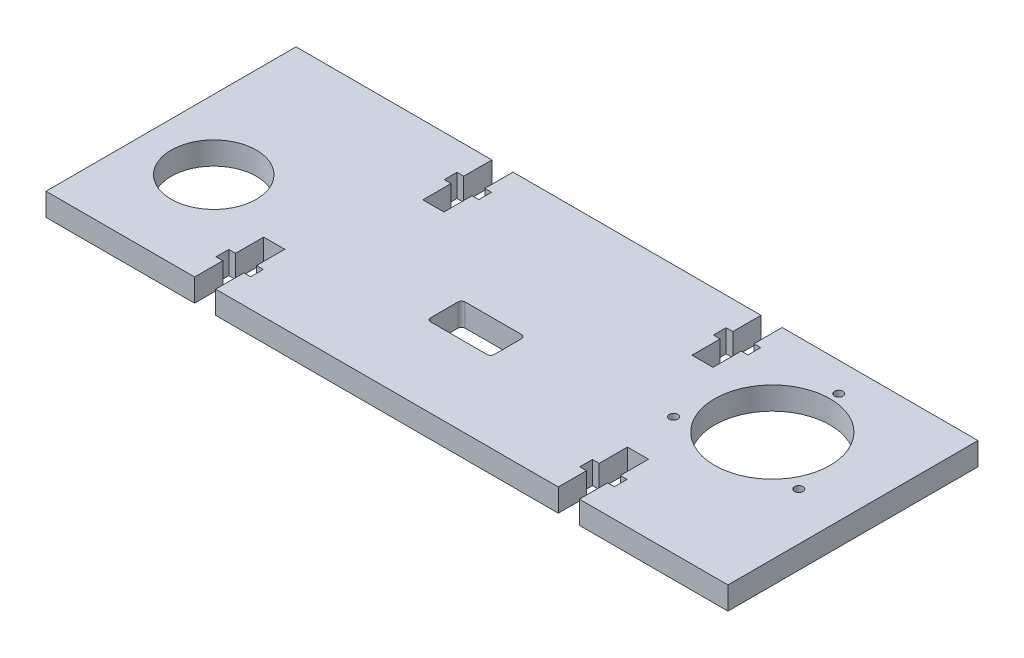
from build123d import *

# Parameters (mm, degrees)
SKETCH1_W                 = 95.25
SKETCH1_H                 = 34.925
BOSS_EXTRUDE1_DEPTH       = 3.175
TAP_DRILL_FOR_0_80_TAP1_D = 1.19126
F_7_16_CLEARANCE_HOLE1_D  = 11.90498
SKETCH6_W                 = 8.89
SKETCH6_H                 = 4.826
CUT_EXTRUDE1_DEPTH        = 51.824798635
CUT_EXTRUDE3_DEPTH        = 51.824798635
SKETCH9_R                 = 8.0645
CUT_EXTRUDE4_DEPTH        = 51.824798635
FILLET1_R                 = 0.508


with BuildPart() as part:
    # Sketch1 → Boss-Extrude1 (new body)
    with BuildSketch(Plane(origin=(0, 0, 0), x_dir=(1, 0, 0), z_dir=(0, 1, 0))):
        Rectangle(SKETCH1_W, SKETCH1_H)
    extrude(amount=BOSS_EXTRUDE1_DEPTH)

    # Tap Drill for #0-80 Tap1 (through all)
    with Locations(Plane(origin=(0, 3.175, 0), x_dir=(1, 0, 0), z_dir=(0, 1, 0))):
        with Locations((40.97655, -0.920821886), (23.48865, -0.920821886), (32.2326, 13.40485)):
            Hole(TAP_DRILL_FOR_0_80_TAP1_D / 2)

    # 7/16 Clearance Hole1 (through all)
    with Locations(Plane(origin=(0, 3.175, 0), x_dir=(1, 0, 0), z_dir=(0, 1, 0))):
        with Locations((-37.9095, -3.7465)):
            Hole(F_7_16_CLEARANCE_HOLE1_D / 2)

    # Sketch6 → Cut-Extrude1 (cut, through all)
    with BuildSketch(Plane(origin=(0, 3.175, 0), x_dir=(1, 0, 0), z_dir=(0, 1, 0))):
        with Locations((-1.016, -4.0005)):
            Rectangle(SKETCH6_W, SKETCH6_H)
    extrude(amount=-CUT_EXTRUDE1_DEPTH, mode=Mode.SUBTRACT)

    # Sketch8 → Cut-Extrude3 (cut, through all)
    with BuildSketch(Plane(origin=(0, 3.175, 0), x_dir=(1, 0, 0), z_dir=(0, 1, 0))):
        Polygon((23.9268, -17.4625), (26.8732, -17.4625), (26.8732, -13.5255), (27.813, -13.5255), (27.813, -11.7475), (26.8732, -11.7475), (26.8732, -7.8105), (23.9268, -7.8105), (23.9268, -11.7475), (22.987, -11.7475), (22.987, -13.5255), (23.9268, -13.5255), align=None)
        Polygon((-26.8732, -17.4625), (-23.9268, -17.4625), (-23.9268, -13.5255), (-22.987, -13.5255), (-22.987, -11.7475), (-23.9268, -11.7475), (-23.9268, -7.8105), (-26.8732, -7.8105), (-26.8732, -11.7475), (-27.813, -11.7475), (-27.813, -13.5255), (-26.8732, -13.5255), align=None)
        Polygon((17.3228, 11.7475), (17.3228, 7.8105), (20.2692, 7.8105), (20.2692, 11.7475), (21.209, 11.7475), (21.209, 13.5255), (20.2692, 13.5255), (20.2692, 17.4625), (17.3228, 17.4625), (17.3228, 13.5255), (16.383, 13.5255), (16.383, 11.7475), align=None)
        Polygon((-20.2692, 11.7475), (-20.2692, 7.8105), (-17.3228, 7.8105), (-17.3228, 11.7475), (-16.383, 11.7475), (-16.383, 13.5255), (-17.3228, 13.5255), (-17.3228, 17.4625), (-20.2692, 17.4625), (-20.2692, 13.5255), (-21.209, 13.5255), (-21.209, 11.7475), align=None)
    extrude(amount=-CUT_EXTRUDE3_DEPTH, mode=Mode.SUBTRACT)

    # Sketch9 → Cut-Extrude4 (cut, through all)
    with BuildSketch(Plane(origin=(0, 3.175, 0), x_dir=(1, 0, 0), z_dir=(0, 1, 0))):
        with Locations((32.2326, 4.1275)):
            Circle(SKETCH9_R)
    extrude(amount=-CUT_EXTRUDE4_DEPTH, mode=Mode.SUBTRACT)

    # Fillet1
    fillet1_edges = [part.edges().sort_by_distance(p)[0] for p in [
        (3.429, 1.5875, 1.5875),
        (-5.461, 1.5875, 1.5875),
        (-5.461, 1.5875, 6.4135),
        (3.429, 1.5875, 6.4135),
    ]]
    fillet(fillet1_edges, radius=FILLET1_R)


solid = part.part
